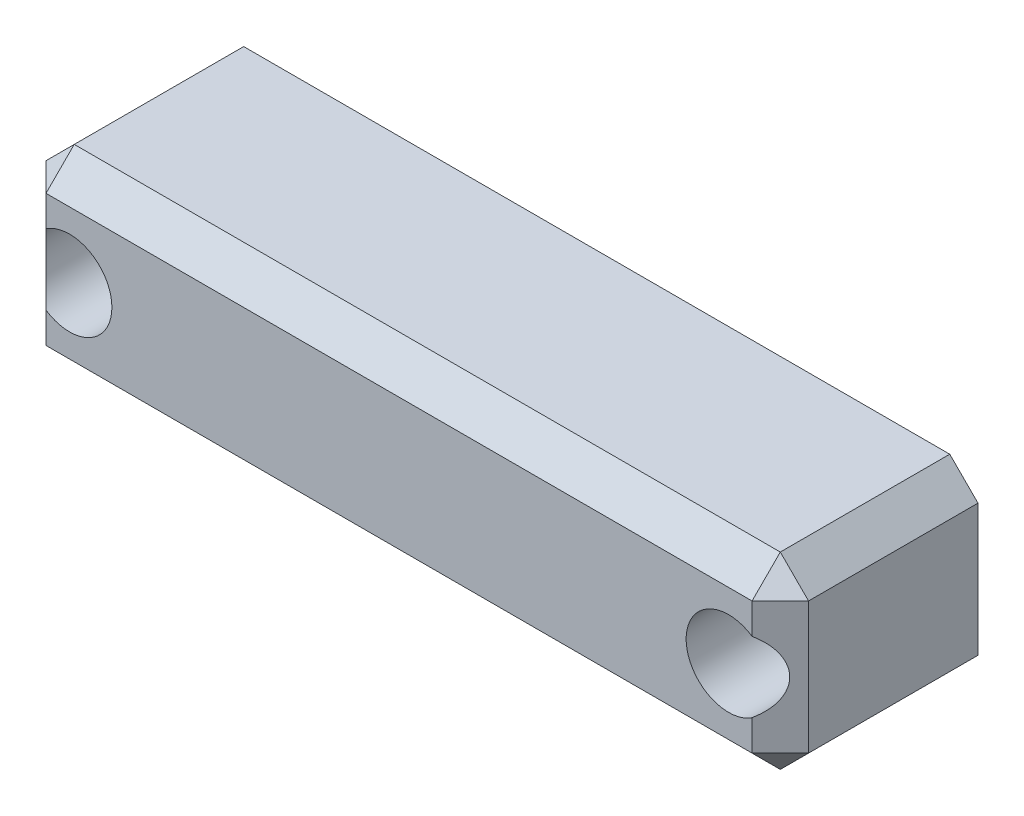
from build123d import *

# Parameters (mm, degrees)
SKETCH1_W           = 81
SKETCH1_H           = 20
SKETCH1_R           = 1.6
BOSS_EXTRUDE1_DEPTH = 2
SKETCH2_W           = 81
SKETCH2_H           = 20
BOSS_EXTRUDE2_DEPTH = 19
SKETCH3_R           = 4.5
CUT_EXTRUDE1_DEPTH  = 16.5
SKETCH4_W           = 1.55073591
SKETCH4_H           = 9.649023437
CUT_EXTRUDE2_DEPTH  = 0.6
SKETCH5_W           = 8.2
SKETCH5_H           = 3.2
CUT_EXTRUDE3_DEPTH  = 15


with BuildPart() as part:
    # Sketch1 → Boss-Extrude1 (new body)
    with BuildSketch(Plane.XY):
        Rectangle(SKETCH1_W, SKETCH1_H)
        with Locations((-35, 0)):
            Circle(SKETCH1_R, mode=Mode.SUBTRACT)
        with Locations(Location((35, 0, 0), (0, 0, 180))):
            Circle(SKETCH1_R, mode=Mode.SUBTRACT)
    extrude(amount=BOSS_EXTRUDE1_DEPTH)

    # Sketch2 → Boss-Extrude2 (add)
    with BuildSketch(Plane.XY.offset(2)):
        Rectangle(SKETCH2_W, SKETCH2_H)
        Polygon((-35, 3.290896534), (-37.85, 1.645448267), (-37.85, -1.645448267), (-35, -3.290896534), (-32.15, -1.645448267), (-32.15, 1.645448267), align=None, mode=Mode.SUBTRACT)
        Polygon((32.15, 1.645448267), (35, 3.290896534), (37.85, 1.645448267), (37.85, -1.645448267), (35, -3.290896534), (32.15, -1.645448267), align=None, mode=Mode.SUBTRACT)
    extrude(amount=BOSS_EXTRUDE2_DEPTH)

    # Sketch3 → Cut-Extrude1 (cut)
    with BuildSketch(Plane.XY.offset(21)):
        with Locations((-35, 0)):
            Circle(SKETCH3_R)
        with Locations((35, 0)):
            Circle(SKETCH3_R)
    extrude(amount=-CUT_EXTRUDE1_DEPTH, mode=Mode.SUBTRACT)

    # Sketch4 → Cut-Extrude2 (cut)
    # profile 1 of 6: a face of its own
    with BuildSketch(Plane.XZ.offset(10)):
        Polygon((-33.587744141, 5), (-33.587744141, 14.649023437), (-32.037008231, 14.649023437), (-32.037008231, 6.37843192), (-24.800240653, 6.37843192), (-24.800240653, 5), align=None)
    # profile 2 of 6: a face of its own
    with BuildSketch(Plane.XZ.offset(10)):
        with Locations((-20.578792899, 9.824511719)):
            Rectangle(SKETCH4_W, SKETCH4_H)
    # profile 3 of 6: a face of its own
    with BuildSketch(Plane.XZ.offset(10)):
        with BuildLine():
            add(Edge.make_bspline(
                [(-14.806609235, 12.309458324), (-14.804976638, 12.417187753), (-14.801830444, 12.624794173), (-14.780360358, 12.922271361), (-14.746580088, 13.194148567), (-14.69625234, 13.438234095), (-14.631193226, 13.656130227), (-14.554953501, 13.849043948), (-14.460040956, 14.014370688), (-14.350731056, 14.15743944), (-14.216295599, 14.274520407), (-14.062165448, 14.379065309), (-13.877984465, 14.460554287), (-13.670915235, 14.53083923), (-13.436958779, 14.583000762), (-13.17821625, 14.624501299), (-12.891811892, 14.643830455), (-12.692313203, 14.647242632), (-12.588195365, 14.649023437)],
                knots=[0, 0, 0, 0, 1.356036651, 2.613231268, 3.752414623, 4.802589533, 5.746123943, 6.612521098, 7.406998526, 8.13920042, 8.867207282, 9.641098261, 10.475072736, 11.393174703, 12.390623068, 13.488272118, 14.689135851, 16, 16, 16, 16], degree=3))
            Line((-12.588195365, 14.649023437), (-5.825263759, 14.649023437))
            add(Edge.make_bspline(
                [(-5.825263759, 14.649023437), (-5.722036878, 14.647268821), (-5.524318348, 14.643908068), (-5.239792064, 14.624195065), (-4.981730898, 14.583414863), (-4.748702329, 14.529585308), (-4.539394098, 14.464935227), (-4.35838857, 14.377777795), (-4.201499143, 14.277890519), (-4.068341181, 14.159095875), (-3.956609032, 14.018508531), (-3.860419483, 13.85388067), (-3.78576721, 13.660983495), (-3.716241435, 13.444194807), (-3.666926103, 13.198572915), (-3.633222369, 12.925862001), (-3.611543893, 12.626588141), (-3.608457726, 12.418084801), (-3.606849888, 12.309458324)],
                knots=[0, 0, 0, 0, 1.299933517, 2.489864488, 3.587819575, 4.585546039, 5.500351598, 6.339366304, 7.107262543, 7.835472382, 8.574905516, 9.35982342, 10.226462136, 11.173568469, 12.22403618, 13.374743709, 14.632288846, 16, 16, 16, 16], degree=3))
            Line((-3.606849888, 12.309458324), (-3.606849888, 7.293796866))
            add(Edge.make_bspline(
                [(-3.606849888, 7.293796866), (-3.608489521, 7.186966667), (-3.611648301, 6.981156498), (-3.633005697, 6.686337572), (-3.667125703, 6.417236061), (-3.716381817, 6.17525737), (-3.784884917, 5.961573087), (-3.862023469, 5.772561208), (-3.954958176, 5.609535167), (-4.068627152, 5.473476039), (-4.202530951, 5.360498962), (-4.358409133, 5.262868225), (-4.540132402, 5.179477062), (-4.748248103, 5.113240577), (-4.981934254, 5.063165897), (-5.240003929, 5.025535864), (-5.524295996, 5.004910057), (-5.722029211, 5.001684192), (-5.825263759, 5)],
                knots=[0, 0, 0, 0, 1.357542853, 2.615329061, 3.754047103, 4.803056721, 5.748032163, 6.601604192, 7.393772167, 8.122398936, 8.842316527, 9.611155812, 10.45306815, 11.376323517, 12.380743902, 13.487137316, 14.688059353, 16, 16, 16, 16], degree=3))
            Line((-5.825263759, 5), (-6.942547444, 5))
            Line((-6.942547444, 5), (-5.787572261, 2.587744141))
            Line((-5.787572261, 2.587744141), (-7.341000421, 2.587744141))
            Line((-7.341000421, 2.587744141), (-8.37751661, 5))
            Line((-8.37751661, 5), (-12.588195365, 5))
            add(Edge.make_bspline(
                [(-12.588195365, 5), (-12.692332349, 5.001666446), (-12.891867723, 5.0048595), (-13.17788801, 5.025674062), (-13.437329668, 5.062181074), (-13.670252405, 5.116660391), (-13.878627595, 5.182170476), (-14.061285114, 5.265158444), (-14.216225526, 5.366198215), (-14.350572011, 5.480742741), (-14.460132732, 5.621015272), (-14.554186249, 5.783156396), (-14.63249249, 5.972639282), (-14.694819997, 6.186908635), (-14.747470023, 6.426831218), (-14.779860155, 6.692711929), (-14.802026195, 6.984711799), (-14.805038338, 7.187853853), (-14.806609235, 7.293796866)],
                knots=[0, 0, 0, 0, 1.324036824, 2.536967853, 3.643942933, 4.651414504, 5.575155256, 6.417510213, 7.192906735, 7.920665353, 8.651280738, 9.443865181, 10.297885959, 11.250901803, 12.278145285, 13.417461987, 14.653150085, 16, 16, 16, 16], degree=3))
            Line((-14.806609235, 7.293796866), (-14.806609235, 12.309458324))
        make_face()
        Polygon((-7.583302907, 6.37843192), (-5.157585798, 6.37843192), (-5.157585798, 13.270591518), (-13.255873326, 13.270591518), (-13.255873326, 6.37843192), (-9.007503074, 6.37843192), (-10.017096765, 8.545693043), (-8.915966579, 8.962991769), align=None, mode=Mode.SUBTRACT)
    # profile 4 of 6: a face of its own
    with BuildSketch(Plane.XZ.offset(10)):
        with BuildLine():
            Line((2.59609375, 14.649023437), (2.59609375, 6.37843192))
            Line((2.59609375, 6.37843192), (9.660557338, 6.37843192))
            Line((9.660557338, 6.37843192), (9.660557338, 14.649023437))
            Line((9.660557338, 14.649023437), (11.211293248, 14.649023437))
            Line((11.211293248, 14.649023437), (11.211293248, 7.315334865))
            add(Edge.make_bspline(
                [(11.211293248, 7.315334865), (11.209671407, 7.207602497), (11.206545941, 6.999990416), (11.184933541, 6.702552103), (11.15173194, 6.431418545), (11.1001524, 6.188596463), (11.037275849, 5.971305526), (10.95630111, 5.781699973), (10.862264692, 5.618226105), (10.752425747, 5.478232852), (10.619016165, 5.363168222), (10.462368541, 5.265654029), (10.281469291, 5.182531485), (10.074172462, 5.116191019), (9.841993577, 5.062255924), (9.583462024, 5.025819187), (9.300144583, 5.004898837), (9.103298675, 5.001675731), (9.000956127, 5)],
                knots=[0, 0, 0, 0, 1.365025829, 2.630554399, 3.777289411, 4.823296905, 5.773086012, 6.639126, 7.429026898, 8.157168554, 8.882463115, 9.649102086, 10.488604984, 11.398409027, 12.402469484, 13.50569655, 14.703181711, 16, 16, 16, 16], degree=3))
            Line((9.000956127, 5), (3.247618212, 5))
            add(Edge.make_bspline(
                [(3.247618212, 5), (3.145292456, 5.001789232), (2.948478847, 5.005230644), (2.66569074, 5.024597558), (2.409500396, 5.065711797), (2.178924598, 5.119042379), (1.972601281, 5.185421687), (1.790775096, 5.267931064), (1.634876222, 5.368767455), (1.50127686, 5.486334092), (1.39265983, 5.628776591), (1.296937845, 5.791748601), (1.220244082, 5.982828854), (1.156184522, 6.199233609), (1.105265161, 6.441365656), (1.071783079, 6.709713178), (1.050021999, 7.003574692), (1.046956174, 7.208499571), (1.04535784, 7.315334865)],
                knots=[0, 0, 0, 0, 1.300701479, 2.501772386, 3.598738778, 4.594699887, 5.507228244, 6.349244948, 7.124330105, 7.859357323, 8.598620027, 9.390886202, 10.255090117, 11.20772327, 12.256862927, 13.395722128, 14.642288861, 16, 16, 16, 16], degree=3))
            Line((1.04535784, 7.315334865), (1.04535784, 14.649023437))
            Line((1.04535784, 14.649023437), (2.59609375, 14.649023437))
        make_face()
    # profile 5 of 6: a face of its own
    with BuildSketch(Plane.XZ.offset(10)):
        with Locations((16.983476911, 9.824511719)):
            Rectangle(SKETCH4_W, SKETCH4_H)
    # profile 6 of 6: a face of its own
    with BuildSketch(Plane.XZ.offset(10)):
        with BuildLine():
            add(Edge.make_bspline(
                [(28.005547769, 14.649023437), (28.220963951, 14.647060532), (28.633214934, 14.643304037), (29.222694606, 14.612345216), (29.754705683, 14.556375231), (30.234235947, 14.479043695), (30.669444032, 14.377276519), (31.066635627, 14.247887497), (31.430977719, 14.094215088), (31.651215066, 13.964024288), (31.75854405, 13.900577981)],
                knots=[0, 0, 0, 0, 1.333748036, 2.552449549, 3.653284149, 4.644416963, 5.558188665, 6.417438134, 7.22876497, 8, 8, 8, 8], degree=3))
            add(Edge.make_bspline(
                [(31.75854405, 13.900577981), (31.910876665, 13.793464862), (32.215012287, 13.579611018), (32.613198251, 13.181816696), (32.959372693, 12.72785368), (33.253876196, 12.223163934), (33.490051358, 11.678221951), (33.661304035, 11.102808198), (33.762208061, 10.501125421), (33.776082771, 10.091421962), (33.783115932, 9.883741215)],
                knots=[0, 0, 0, 0, 0.952233827, 1.901157072, 2.86814827, 3.869170434, 4.885987205, 5.902388466, 6.936710154, 8, 8, 8, 8], degree=3))
            add(Edge.make_bspline(
                [(33.783115932, 9.883741215), (33.777441587, 9.66346742), (33.766332594, 9.232224726), (33.663473361, 8.602629237), (33.498019863, 8.006262513), (33.26209058, 7.450154756), (32.974859688, 6.935269721), (32.621587856, 6.481042787), (32.223872774, 6.073016355), (31.914021726, 5.85689251), (31.75854405, 5.748445456)],
                knots=[0, 0, 0, 0, 1.10009359, 2.153716578, 3.178805282, 4.185820525, 5.165972868, 6.115914832, 7.054599989, 8, 8, 8, 8], degree=3))
            add(Edge.make_bspline(
                [(31.75854405, 5.748445456), (31.653854534, 5.686883988), (31.437833829, 5.55985549), (31.078927075, 5.409045508), (30.684503958, 5.279880807), (30.249671556, 5.17506429), (29.767541024, 5.094220294), (29.231511975, 5.040642983), (28.637823637, 5.00454391), (28.222783469, 5.001561185), (28.005547769, 5)],
                knots=[0, 0, 0, 0, 0.751442197, 1.55055711, 2.404733238, 3.320026642, 4.317797691, 5.429952807, 6.654814532, 8, 8, 8, 8], degree=3))
            Line((28.005547769, 5), (22.755660575, 5))
            Line((22.755660575, 5), (22.755660575, 14.649023437))
            Line((22.755660575, 14.649023437), (28.005547769, 14.649023437))
        make_face()
        with BuildLine():
            Line((27.776706532, 13.270591518), (24.306396484, 13.270591518))
            Line((24.306396484, 13.270591518), (24.306396484, 6.37843192))
            Line((24.306396484, 6.37843192), (27.776706532, 6.37843192))
            add(Edge.make_bspline(
                [(27.776706532, 6.37843192), (27.96523394, 6.380996011), (28.328328204, 6.385934321), (28.851381508, 6.423955498), (29.331911923, 6.483860827), (29.769821399, 6.571377958), (30.163086619, 6.687022994), (30.515259384, 6.823489779), (30.824791787, 6.987069157), (31.092883082, 7.180402185), (31.323894789, 7.404135372), (31.524749393, 7.657160192), (31.688720321, 7.948478551), (31.826619925, 8.26850472), (31.929865204, 8.623388079), (32.009394772, 9.008361751), (32.049889997, 9.42879125), (32.056595924, 9.719443209), (32.060076032, 9.870279966)],
                knots=[0, 0, 0, 0, 1.409644703, 2.71490448, 3.919338159, 5.028796387, 6.050167232, 6.981044467, 7.848698272, 8.660802914, 9.443886324, 10.246705002, 11.067414674, 11.9362355, 12.847037354, 13.826200672, 14.871884975, 16, 16, 16, 16], degree=3))
            add(Edge.make_bspline(
                [(32.060076032, 9.870279966), (32.056957672, 10.015782593), (32.050935449, 10.296779445), (32.005326668, 10.703251857), (31.928428645, 11.077540531), (31.820300734, 11.420541106), (31.683039135, 11.733063641), (31.51420012, 12.01549691), (31.308555196, 12.262428801), (31.074921098, 12.481926115), (30.801387388, 12.669196547), (30.491763471, 12.834544191), (30.137296372, 12.965889517), (29.7456571, 13.08098784), (29.310649796, 13.162998243), (28.836575861, 13.229847978), (28.320072796, 13.261742312), (27.962500064, 13.267565704), (27.776706532, 13.270591518)],
                knots=[0, 0, 0, 0, 1.103072798, 2.130270712, 3.096451282, 3.99597478, 4.851981305, 5.679355857, 6.481758973, 7.280982183, 8.102093443, 8.987871863, 9.935618735, 10.962816649, 12.079758563, 13.288420765, 14.591072985, 16, 16, 16, 16], degree=3))
        make_face(mode=Mode.SUBTRACT)
    extrude(amount=-CUT_EXTRUDE2_DEPTH, mode=Mode.SUBTRACT)

    # Sketch5 → Cut-Extrude3 (cut)
    with BuildSketch(Plane(origin=(0, 0, 0), x_dir=(-1, 0, 0), z_dir=(0, 0, -1))):
        with Locations((-20.1, -7.4)):
            Rectangle(SKETCH5_W, SKETCH5_H)
        with Locations((20.1, -7.4)):
            Rectangle(SKETCH5_W, SKETCH5_H)
    extrude(amount=-CUT_EXTRUDE3_DEPTH, mode=Mode.SUBTRACT)

    # Chamfer1
    # the kernel refuses this chamfer: 3 mm, written as the material it takes off along each edge
    with BuildSketch(Plane(origin=(-38.5, -8, 19), x_dir=(-0.7071067811865469, 0.7071067811865482, 0), z_dir=(-0.5773502691896266, -0.5773502691896256, 0.577350269189625)), Plane(origin=(38.5, -8, 19), x_dir=(0, 0.7071067811865476, 0.7071067811865476), z_dir=(0.5773502691896257, -0.5773502691896257, 0.5773502691896257))) as chamfer1_piece_1:
        Polygon((-2.121320344, 1.224744871), (2.121320344, 1.224744871), (0, -2.449489743), align=None)
    extrude(amount=3.810511777, mode=Mode.SUBTRACT)
    with BuildSketch(Plane(origin=(-38.5, 8, 19), x_dir=(-0.7071067811865476, -0.7071067811865476, 0), z_dir=(-0.5773502691896257, 0.5773502691896257, 0.577350269189626)), Plane(origin=(38.5, 8, 19), x_dir=(0, -0.707106781186548, 0.7071067811865471), z_dir=(0.577350269189626, 0.5773502691896253, 0.577350269189626))) as chamfer1_piece_2:
        Polygon((-2.121320344, -1.224744871), (2.121320344, -1.224744871), (0, 2.449489743), align=None)
    extrude(amount=3.810511777, mode=Mode.SUBTRACT)
    with BuildSketch(Plane(origin=(-40.5, -17.715048964, 21), x_dir=(-0.027495876610586768, 0, -0.9996219169112968), z_dir=(0, 1, 0))) as chamfer1_piece_3:
        with BuildLine():
            Line((3.086019586, 0), (-0.169641465, -3.081353381))
            Line((-0.169641465, -3.081353381), (-0.22961878, -3.079703628))
            ThreePointArc((-0.22961878, -3.079703628), (-0.102387681, -1.540193489), (-0.059977315, 0.001649753))
            Line((-0.059977315, 0.001649753), (0.001649753, 0.059977315))
            ThreePointArc((0.001649753, 0.059977315), (1.543492994, 0.017566949), (3.087669338, 0.059977315))
            Line((3.087669338, 0.059977315), (3.086019586, 0))
        make_face()
    extrude(amount=35.430097928, mode=Mode.SUBTRACT)
    with BuildSketch(Plane(origin=(48.215048964, -10, 21), x_dir=(0, -0.02749587661058619, -0.9996219169112968), z_dir=(-1, 0, 0))) as chamfer1_piece_4:
        with BuildLine():
            Line((3.086019586, 0), (-0.169641465, -3.081353381))
            Line((-0.169641465, -3.081353381), (-0.22961878, -3.079703628))
            ThreePointArc((-0.22961878, -3.079703628), (-0.102387681, -1.540193489), (-0.059977315, 0.001649753))
            Line((-0.059977315, 0.001649753), (0.001649753, 0.059977315))
            ThreePointArc((0.001649753, 0.059977315), (1.543492994, 0.017566949), (3.087669338, 0.059977315))
            Line((3.087669338, 0.059977315), (3.086019586, 0))
        make_face()
    extrude(amount=96.430097928, mode=Mode.SUBTRACT)
    with BuildSketch(Plane(origin=(40.5, 17.715048964, 21), x_dir=(-0.9996219169112965, 0, 0.02749587661058676), z_dir=(0, -1, 0))) as chamfer1_piece_5:
        with BuildLine():
            Line((3.086019586, 0), (-0.169641465, 3.081353381))
            Line((-0.169641465, 3.081353381), (-0.22961878, 3.079703628))
            ThreePointArc((-0.22961878, 3.079703628), (-0.102387681, 1.540193489), (-0.059977315, -0.001649753))
            Line((-0.059977315, -0.001649753), (0.001649753, -0.059977315))
            ThreePointArc((0.001649753, -0.059977315), (1.543492994, -0.017566949), (3.087669338, -0.059977315))
            Line((3.087669338, -0.059977315), (3.086019586, 0))
        make_face()
    extrude(amount=35.430097928, mode=Mode.SUBTRACT)
    with BuildSketch(Plane(origin=(-48.215048964, 10, 21), x_dir=(0, -0.9996219169112968, 0.027495876610586775), z_dir=(1, 0, 0))) as chamfer1_piece_6:
        with BuildLine():
            Line((3.086019586, 0), (-0.169641465, 3.081353381))
            Line((-0.169641465, 3.081353381), (-0.22961878, 3.079703628))
            ThreePointArc((-0.22961878, 3.079703628), (-0.102387681, 1.540193489), (-0.059977315, -0.001649753))
            Line((-0.059977315, -0.001649753), (0.001649753, -0.059977315))
            ThreePointArc((0.001649753, -0.059977315), (1.543492994, -0.017566949), (3.087669338, -0.059977315))
            Line((3.087669338, -0.059977315), (3.086019586, 0))
        make_face()
    extrude(amount=96.430097928, mode=Mode.SUBTRACT)
    with BuildSketch(Plane(origin=(40.5, -10, -7.715048964), x_dir=(-0.9996219169112968, -0.02749587661058619, 0), z_dir=(0, 0, 1)), Plane(origin=(-40.5, -10, 28.715048964), x_dir=(0.9996219169112968, -0.02749587661058619, 0), z_dir=(0, 0, -1)), Plane(origin=(-40.5, 10, 28.715048964), x_dir=(-0.027495876610586775, -0.9996219169112968, 0), z_dir=(0, 0, -1)), Plane(origin=(40.5, 10, -7.715048964), x_dir=(0.027495876610586775, -0.9996219169112968, 0), z_dir=(0, 0, 1))) as chamfer1_piece_7:
        with BuildLine():
            Line((3.086019586, 0), (-0.169641465, -3.081353381))
            Line((-0.169641465, -3.081353381), (-0.22961878, -3.079703628))
            ThreePointArc((-0.22961878, -3.079703628), (-0.102387681, -1.540193489), (-0.059977315, 0.001649753))
            Line((-0.059977315, 0.001649753), (0.001649753, 0.059977315))
            ThreePointArc((0.001649753, 0.059977315), (1.543492994, 0.017566949), (3.087669338, 0.059977315))
            Line((3.087669338, 0.059977315), (3.086019586, 0))
        make_face()
    extrude(amount=36.430097928, mode=Mode.SUBTRACT)


solid = part.part
